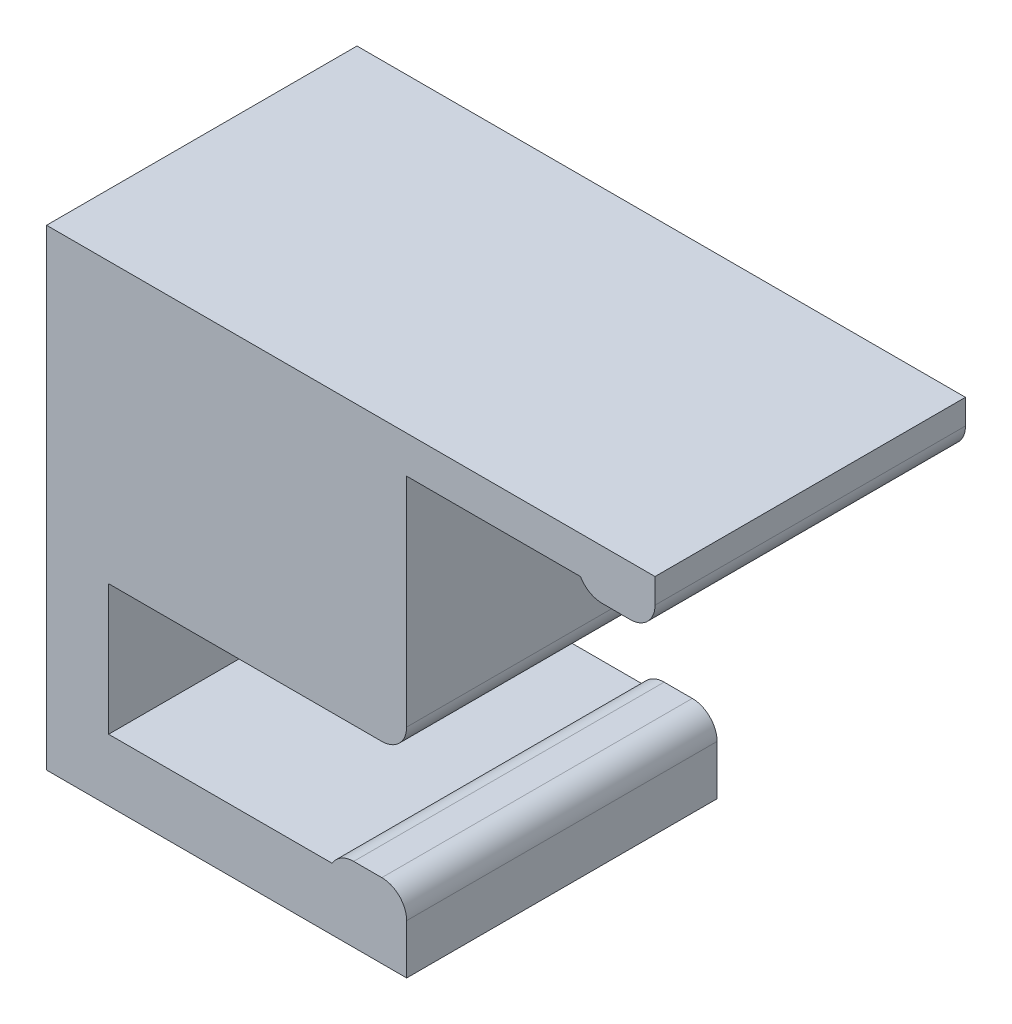
from build123d import *

# Parameters (mm, degrees)
SKETCH1_W           = 3
SKETCH1_H           = 0.5
BOSS_EXTRUDE1_DEPTH = 12.5
FILLET1_R           = 1


with BuildPart() as part:
    # Sketch1 → Boss-Extrude1 (new body)
    with BuildSketch(Plane.XY):
        Polygon((14.5, 17.5), (14.5, 7.75), (2.5, 7.75), (2.5, 2.5), (14.5, 2.5), (14.5, 0), (0, 0), (0, 19), (24.5, 19), (24.5, 17.5), align=None)
        with Locations((23, 17.25)):
            Rectangle(SKETCH1_W, SKETCH1_H)
        with Locations((13, 2.75)):
            Rectangle(SKETCH1_W, SKETCH1_H)
    extrude(amount=BOSS_EXTRUDE1_DEPTH)

    # Fillet1
    # the kernel refuses this fillet: 1 mm, written as the material it takes off along each edge
    with BuildSketch(Plane(origin=(24.5, 17, -2.5), x_dir=(-1, 0, 0), z_dir=(0, 0, 1)), Plane(origin=(14.5, 3, -2.5), x_dir=(0, -1, 0), z_dir=(0, 0, 1))) as fillet1_piece_1:
        with BuildLine():
            CenterArc((FILLET1_R, -FILLET1_R), FILLET1_R, 90, 90)
            Line((0, -FILLET1_R), (-FILLET1_R * 0.02, -FILLET1_R))
            Line((-FILLET1_R * 0.02, -FILLET1_R), (-FILLET1_R * 0.02, FILLET1_R * 0.02))
            Line((-FILLET1_R * 0.02, FILLET1_R * 0.02), (FILLET1_R, FILLET1_R * 0.02))
            Line((FILLET1_R, FILLET1_R * 0.02), (FILLET1_R, 0))
        make_face()
    extrude(amount=17.5, mode=Mode.SUBTRACT)
    with BuildSketch(Plane(origin=(21.5, 17, -2.165063509), x_dir=(0, 1, 0), z_dir=(0, 0, 1))) as fillet1_piece_2:
        with BuildLine():
            CenterArc((1, -0.866025404), FILLET1_R, 120, 60)
            Line((0, -0.866025404), (-0.02, -0.866025404))
            Line((-0.02, -0.866025404), (-0.02, 0))
            Line((-0.02, 0), (0, 0.02))
            ThreePointArc((0, 0.02), (0.25, 0.02), (0.49, 0.017320508))
            Line((0.49, 0.017320508), (0.5, 0))
        make_face()
    extrude(amount=16.830127019, mode=Mode.SUBTRACT)
    with BuildSketch(Plane(origin=(11.5, 3, -2.165063509), x_dir=(1, 0, 0), z_dir=(0, 0, 1))) as fillet1_piece_3:
        with BuildLine():
            CenterArc((0.866025404, -1), FILLET1_R, 90, 60)
            Line((0, -0.5), (-0.017320508, -0.49))
            ThreePointArc((-0.017320508, -0.49), (-0.02, -0.25), (-0.02, 0))
            Line((-0.02, 0), (0, 0.02))
            Line((0, 0.02), (0.866025404, 0.02))
            Line((0.866025404, 0.02), (0.866025404, 0))
        make_face()
    extrude(amount=16.830127019, mode=Mode.SUBTRACT)
    with BuildSketch(Plane(origin=(14.5, 7.75, -2.5), x_dir=(0, 1, 0), z_dir=(0, 0, 1))) as fillet1_piece_4:
        with BuildLine():
            CenterArc((FILLET1_R, FILLET1_R), FILLET1_R, 180, 90)
            Line((0, FILLET1_R), (-FILLET1_R * 0.02, FILLET1_R))
            Line((-FILLET1_R * 0.02, FILLET1_R), (-FILLET1_R * 0.02, -FILLET1_R * 0.02))
            Line((-FILLET1_R * 0.02, -FILLET1_R * 0.02), (FILLET1_R, -FILLET1_R * 0.02))
            Line((FILLET1_R, -FILLET1_R * 0.02), (FILLET1_R, 0))
        make_face()
    extrude(amount=17.5, mode=Mode.SUBTRACT)


solid = part.part
